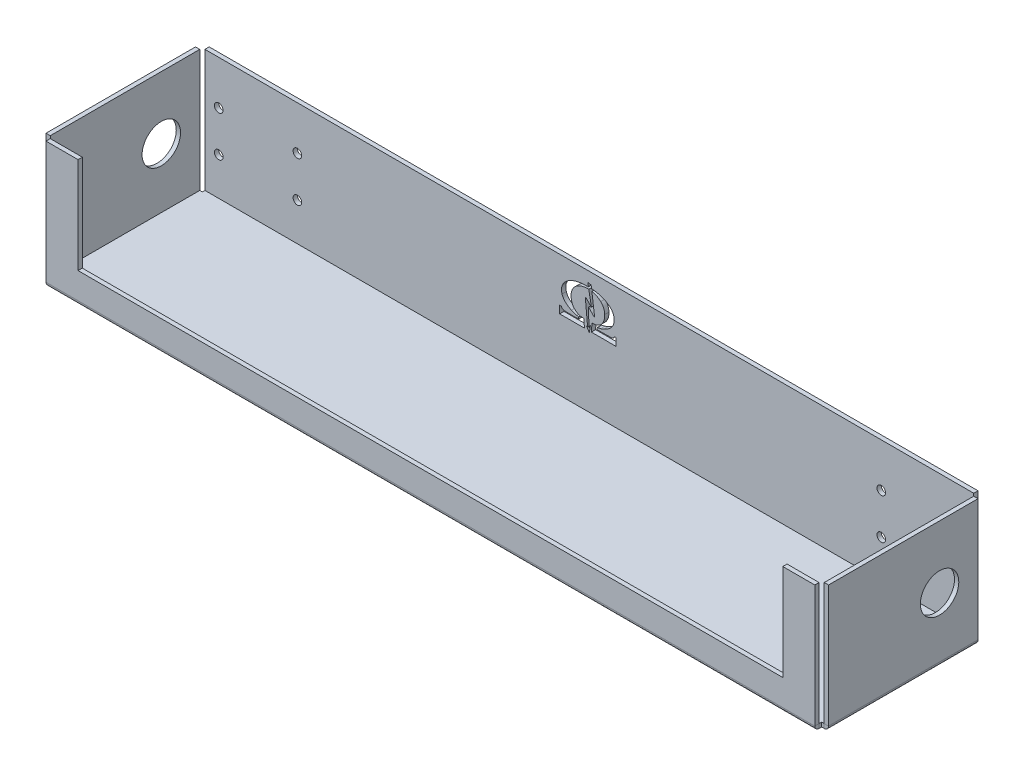
from build123d import *

# Parameters (mm, degrees)
FLANGE_BASE1_DEPTH                             = 2
DOBRA_START                                    = -48.25
DOBRA_ESBO_ADA1_OUTLINE_W                      = 2
DOBRA_ESBO_ADA1_OUTLINE_H                      = 57.214601837
DOBRA_ESBO_ADA1_DEPTH                          = 70
DOBRA_START_2                                  = -180
DOBRA_ESBO_ADA1_2_OUTLINE_W                    = 57.214601837
DOBRA_ESBO_ADA1_2_OUTLINE_H                    = 2
DOBRA_ESBO_ADA1_2_DEPTH                        = 360
DOBRA_START_3                                  = -108.25
DOBRA_ESBO_ADA1_3_OUTLINE_W                    = 360
DOBRA_ESBO_ADA1_3_OUTLINE_H                    = 2
DOBRA_ESBO_ADA1_3_DEPTH                        = 56.785398163
DOBRA_START_4                                  = 24.964601837
DOBRA_ESBO_ADA1_4_OUTLINE_W                    = 360
DOBRA_ESBO_ADA1_4_OUTLINE_H                    = 2
DOBRA_ESBO_ADA1_4_DEPTH                        = 56.785398163
DOBRA_ESBO_ADA1_5_DEPTH                        = 70
DOBRA_ESBO_ADA1_6_DEPTH                        = 360
DOBRA_START_5                                  = -240
DOBRA_ESBO_ADA1_7_OUTLINE_W                    = 2
DOBRA_ESBO_ADA1_7_OUTLINE_H                    = 70
DOBRA_ESBO_ADA1_7_DEPTH                        = 56.785398163
DOBRA_START_6                                  = 183.214601837
DOBRA_ESBO_ADA1_8_OUTLINE_W                    = 2
DOBRA_ESBO_ADA1_8_OUTLINE_H                    = 70
DOBRA_ESBO_ADA1_8_DEPTH                        = 56.785398163
FURO1_START                                    = -183.214601837
FURO1_OUTLINE_R                                = 9
FURO1_DEPTH                                    = 366.429203674
CORTE_EXTRUS_O1_REACH                          = 208.597
ESBO_O9_W                                      = 330
ESBO_O9_H                                      = 45
BROCA_DE_ROSQUEAR_DE_CANO_PARA_TARRAXA_D_D     = 4.04
BROCA_DE_ROSQUEAR_DE_CANO_PARA_TARRAXA_D_DEPTH = 10
BROCA_DE_ROSQUEAR_DE_CANO_PARA_TARRAXA_D_TIP   = 1.21373845
CORTE_EXTRUS_O13_DEPTH                         = 10
CORTE_EXTRUS_O17_DEPTH                         = 10
CORTE_EXTRUS_O19_REACH                         = 208.597


# Read off the part's stored shape, not the designer's step: Dobra esboçada1, Furo1
# Sheet-metal steps are written as plain solids
with BuildPart() as part:
    # Esboço1 → Flange-base1 (new body)
    with BuildSketch(Plane(origin=(0, 0, 0), x_dir=(1, 0, 0), z_dir=(0, 1, 0))):
        Polygon((180, 108.25), (180, 48.25), (240, 48.25), (240, -21.75), (180, -21.75), (180, -81.75), (-180, -81.75), (-180, -21.75), (-240, -21.75), (-240, 48.25), (-180, 48.25), (-180, 108.25), align=None)
    extrude(amount=-FLANGE_BASE1_DEPTH)

    # Dobra esboçada1 outline → Dobra esboçada1 (add)
    with BuildSketch(Plane.XY.offset(DOBRA_START)):
        with Locations((182.214601837, 28.607300919)):
            Rectangle(DOBRA_ESBO_ADA1_OUTLINE_W, DOBRA_ESBO_ADA1_OUTLINE_H)
        with Locations((-182.214601837, 28.607300919)):
            Rectangle(DOBRA_ESBO_ADA1_OUTLINE_W, DOBRA_ESBO_ADA1_OUTLINE_H)
    extrude(amount=DOBRA_ESBO_ADA1_DEPTH)

    # Dobra esbo_ada1 2 outline → Dobra esbo_ada1 2 (add)
    with BuildSketch(Plane.YZ.offset(DOBRA_START_2)):
        with Locations((28.607300919, -50.464601837)):
            Rectangle(DOBRA_ESBO_ADA1_2_OUTLINE_W, DOBRA_ESBO_ADA1_2_OUTLINE_H)
        with Locations((28.607300919, 23.964601837)):
            Rectangle(DOBRA_ESBO_ADA1_2_OUTLINE_W, DOBRA_ESBO_ADA1_2_OUTLINE_H)
    extrude(amount=DOBRA_ESBO_ADA1_2_DEPTH)

    # Dobra esbo_ada1 3 outline → Dobra esbo_ada1 3 (cut)
    with BuildSketch(Plane.XY.offset(DOBRA_START_3)):
        with Locations((0, -1)):
            Rectangle(DOBRA_ESBO_ADA1_3_OUTLINE_W, DOBRA_ESBO_ADA1_3_OUTLINE_H)
    extrude(amount=DOBRA_ESBO_ADA1_3_DEPTH, mode=Mode.SUBTRACT)

    # Dobra esbo_ada1 4 outline → Dobra esbo_ada1 4 (cut)
    with BuildSketch(Plane.XY.offset(DOBRA_START_4)):
        with Locations((0, -1)):
            Rectangle(DOBRA_ESBO_ADA1_4_OUTLINE_W, DOBRA_ESBO_ADA1_4_OUTLINE_H)
    extrude(amount=DOBRA_ESBO_ADA1_4_DEPTH, mode=Mode.SUBTRACT)

    # Dobra esbo_ada1 5 outline → Dobra esbo_ada1 5 (cut)
    with BuildSketch(Plane.XY.offset(DOBRA_START)):
        with BuildLine():
            Line((240, 0), (183.214601837, 0))
            ThreePointArc((183.214601837, 0), (182.628815399, -1.414213562), (181.214601837, -2))
            Line((181.214601837, -2), (240, -2))
            Line((240, -2), (240, 0))
        make_face()
        with BuildLine():
            Line((-240, -2), (-181.214601837, -2))
            ThreePointArc((-181.214601837, -2), (-182.628815399, -1.414213562), (-183.214601837, 0))
            Line((-183.214601837, 0), (-240, 0))
            Line((-240, 0), (-240, -2))
        make_face()
    extrude(amount=DOBRA_ESBO_ADA1_5_DEPTH, mode=Mode.SUBTRACT)

    # Dobra esbo_ada1 6 outline → Dobra esbo_ada1 6 (cut)
    with BuildSketch(Plane.YZ.offset(DOBRA_START_2)):
        with BuildLine():
            Line((0, -108.25), (0, -51.464601837))
            ThreePointArc((0, -51.464601837), (-1.414213562, -50.878815399), (-2, -49.464601837))
            Line((-2, -49.464601837), (-2, -108.25))
            Line((-2, -108.25), (0, -108.25))
        make_face()
        with BuildLine():
            Line((-2, 81.75), (-2, 22.964601837))
            ThreePointArc((-2, 22.964601837), (-1.414213562, 24.378815399), (0, 24.964601837))
            Line((0, 24.964601837), (0, 81.75))
            Line((0, 81.75), (-2, 81.75))
        make_face()
    extrude(amount=DOBRA_ESBO_ADA1_6_DEPTH, mode=Mode.SUBTRACT)

    # Dobra esbo_ada1 7 outline → Dobra esbo_ada1 7 (cut)
    with BuildSketch(Plane.YZ.offset(DOBRA_START_5)):
        with Locations((-1, -13.25)):
            Rectangle(DOBRA_ESBO_ADA1_7_OUTLINE_W, DOBRA_ESBO_ADA1_7_OUTLINE_H)
    extrude(amount=DOBRA_ESBO_ADA1_7_DEPTH, mode=Mode.SUBTRACT)

    # Dobra esbo_ada1 8 outline → Dobra esbo_ada1 8 (cut)
    with BuildSketch(Plane.YZ.offset(DOBRA_START_6)):
        with Locations((-1, -13.25)):
            Rectangle(DOBRA_ESBO_ADA1_8_OUTLINE_W, DOBRA_ESBO_ADA1_8_OUTLINE_H)
    extrude(amount=DOBRA_ESBO_ADA1_8_DEPTH, mode=Mode.SUBTRACT)

    # Furo1 outline → Furo1 (cut)
    with BuildSketch(Plane.YZ.offset(FURO1_START)):
        with Locations((28, -30.25)):
            Circle(FURO1_OUTLINE_R)
    extrude(amount=FURO1_DEPTH, mode=Mode.SUBTRACT)

    # Esboço9 → Corte-extrusão1 (cut, up to next)
    with BuildSketch(Plane.XY.offset(24.964601837), mode=Mode.PRIVATE) as corte_extrus_o1_sk1:
        with Locations((0, 34.714601837)):
            Rectangle(ESBO_O9_W, ESBO_O9_H)
    corte_extrus_o1_tool1 = extrude(corte_extrus_o1_sk1.sketch, amount=-CORTE_EXTRUS_O1_REACH, mode=Mode.PRIVATE) & part.part
    add(corte_extrus_o1_tool1.solids().sort_by_distance((0, 34.714602, 24.964602))[0], mode=Mode.SUBTRACT)

    # Broca de rosquear de cano para tarraxa de 1/81
    with Locations(Plane(origin=(0, 0, -51.464601837), x_dir=(-1, 0, 0), z_dir=(0, 0, -1))):
        with Locations((-173.534601837, 36.714601837), (-136.704601837, 36.714601837), (-136.704601837, 17.714601837), (-173.534601837, 17.714601837), (136.704601837, 36.714601837), (136.704601837, 17.714601837), (173.534601837, 17.714601837), (173.534601837, 36.714601837)):
            Hole(BROCA_DE_ROSQUEAR_DE_CANO_PARA_TARRAXA_D_D / 2, depth=BROCA_DE_ROSQUEAR_DE_CANO_PARA_TARRAXA_D_DEPTH)
            with Locations((0, 0, -(BROCA_DE_ROSQUEAR_DE_CANO_PARA_TARRAXA_D_DEPTH + BROCA_DE_ROSQUEAR_DE_CANO_PARA_TARRAXA_D_TIP / 2))):  # 118° drill point
                Cone(0, BROCA_DE_ROSQUEAR_DE_CANO_PARA_TARRAXA_D_D / 2, BROCA_DE_ROSQUEAR_DE_CANO_PARA_TARRAXA_D_TIP, mode=Mode.SUBTRACT)

    # Esboço18 → Corte-extrusão13 (cut)
    with BuildSketch(Plane(origin=(0, 0, -51.464601837), x_dir=(-1, 0, 0), z_dir=(0, 0, -1))):
        with BuildLine():
            add(Edge.make_bspline(
                [(-7.181231252, 43.249745192), (-7.146688462, 45.281829003), (-6.349114649, 46.622466356), (-5.339149821, 47.603329367)],
                knots=[0.358208955, 0.358208955, 0.358208955, 0.358208955, 0.373134328, 0.373134328, 0.373134328, 0.373134328], degree=3))
            add(Edge.make_bspline(
                [(-5.339149821, 47.603329367), (-4.413923306, 48.501884896), (-2.877422317, 49.421216078), (-1.215926637, 49.667899984)],
                knots=[0.373134328, 0.373134328, 0.373134328, 0.373134328, 0.388059701, 0.388059701, 0.388059701, 0.388059701], degree=3))
            Line((-1.215926637, 49.667899984), (-1.088773731, 50.680011668))
            Line((-1.088773731, 50.680011668), (-2.949858808, 50.45671599))
            add(Edge.make_bspline(
                [(-2.949858808, 50.45671599), (-4.353084378, 50.303596358), (-6.472882566, 49.616523122), (-7.63104857, 48.969433649)],
                knots=[0.089552239, 0.089552239, 0.089552239, 0.089552239, 0.104477612, 0.104477612, 0.104477612, 0.104477612], degree=3))
            add(Edge.make_bspline(
                [(-7.63104857, 48.969433649), (-9.363151938, 48.001678951), (-10.94740626, 46.794339735), (-11.495751746, 44.591688832)],
                knots=[0.104477612, 0.104477612, 0.104477612, 0.104477612, 0.119402985, 0.119402985, 0.119402985, 0.119402985], degree=3))
            add(Edge.make_bspline(
                [(-11.495751746, 44.591688832), (-12.156108558, 41.93910702), (-10.736014839, 39.783028112), (-9.407633873, 38.717347275)],
                knots=[0.119402985, 0.119402985, 0.119402985, 0.119402985, 0.134328358, 0.134328358, 0.134328358, 0.134328358], degree=3))
            add(Edge.make_bspline(
                [(-9.407633873, 38.717347275), (-8.632687234, 38.095645218), (-7.880924362, 37.614499714), (-6.831998084, 37.168226411)],
                knots=[0.134328358, 0.134328358, 0.134328358, 0.134328358, 0.149253731, 0.149253731, 0.149253731, 0.149253731], degree=3))
            add(Edge.make_bspline(
                [(-6.831998084, 37.168226411), (-6.325067597, 36.952552638), (-5.870808901, 36.766298734), (-5.309196077, 36.610430218)],
                knots=[0.149253731, 0.149253731, 0.149253731, 0.149253731, 0.164179104, 0.164179104, 0.164179104, 0.164179104], degree=3))
            Line((-5.309196077, 36.610430218), (-4.037587509, 36.319775533))
            add(Edge.make_bspline(
                [(-4.037587509, 36.319775533), (-3.980292596, 36.311006367), (-3.907060973, 36.300885478), (-3.830876005, 36.287436394)],
                knots=[0.179104478, 0.179104478, 0.179104478, 0.179104478, 0.194029851, 0.194029851, 0.194029851, 0.194029851], degree=3))
            Line((-3.830876005, 36.287436394), (-3.625993304, 36.21736258))
            Line((-3.625993304, 36.21736258), (-3.613055376, 35.343444772))
            add(Edge.make_bspline(
                [(-3.613055376, 35.343444772), (-4.750025443, 35.338719419), (-9.564865472, 35.241906464), (-10.491409634, 35.501301118)],
                knots=[0.223880597, 0.223880597, 0.223880597, 0.223880597, 0.23880597, 0.23880597, 0.23880597, 0.23880597], degree=3))
            add(Edge.make_bspline(
                [(-10.491409634, 35.501301118), (-10.933332431, 35.625023598), (-11.362919328, 35.770350941), (-11.596699385, 36.169984094)],
                knots=[0.23880597, 0.23880597, 0.23880597, 0.23880597, 0.253731343, 0.253731343, 0.253731343, 0.253731343], degree=3))
            add(Edge.make_bspline(
                [(-11.596699385, 36.169984094), (-11.665410116, 36.287436394), (-11.707302193, 36.438897609), (-11.782146797, 36.534029428)],
                knots=[0.253731343, 0.253731343, 0.253731343, 0.253731343, 0.268656716, 0.268656716, 0.268656716, 0.268656716], degree=3))
            Line((-11.782146797, 36.534029428), (-12.51529223, 36.531950727))
            Line((-12.51529223, 36.531950727), (-12.508022456, 32.980722514))
            add(Edge.make_bspline(
                [(-12.508022456, 32.980722514), (-12.325358004, 33.045332638), (-1.971699244, 33.033348869), (-0.9179681, 33.008642993)],
                knots=[0.298507463, 0.298507463, 0.298507463, 0.298507463, 0.313432836, 0.313432836, 0.313432836, 0.313432836], degree=3))
            add(Edge.make_bspline(
                [(-0.9179681, 33.008642993), (-0.884186365, 33.460027856), (-1.298279555, 36.522511379), (-1.216608178, 36.820220018)],
                knots=[0.313432836, 0.313432836, 0.313432836, 0.313432836, 0.328358209, 0.328358209, 0.328358209, 0.328358209], degree=3))
            add(Edge.make_bspline(
                [(-1.216608178, 36.820220018), (-2.342843968, 36.890452858), (-2.938045423, 36.901561983), (-3.846324276, 37.296935503)],
                knots=[0.328358209, 0.328358209, 0.328358209, 0.328358209, 0.343283582, 0.343283582, 0.343283582, 0.343283582], degree=3))
            add(Edge.make_bspline(
                [(-3.846324276, 37.296935503), (-6.131294021, 38.29156565), (-7.227803247, 40.510369084), (-7.181231252, 43.249745192)],
                knots=[0.343283582, 0.343283582, 0.343283582, 0.343283582, 0.358208955, 0.358208955, 0.358208955, 0.358208955], degree=3))
        make_face()
        with BuildLine():
            add(Edge.make_bspline(
                [(12.633494226, 45.334205459), (11.811191819, 47.297885233), (10.044727406, 48.579932744), (7.998456175, 49.456133715)],
                knots=[0.955223881, 0.955223881, 0.955223881, 0.955223881, 0.970149254, 0.970149254, 0.970149254, 0.970149254], degree=3))
            add(Edge.make_bspline(
                [(7.998456175, 49.456133715), (5.822896541, 50.387687206), (3.226235201, 50.727219768), (0.465526847, 50.721642488)],
                knots=[0.970149254, 0.970149254, 0.970149254, 0.970149254, 1, 1, 1, 1], degree=3))
            Line((0.465526847, 50.721642488), (0.280340692, 49.793792038))
            Line((0.280340692, 49.793792038), (1.138412662, 49.826460589))
            add(Edge.make_bspline(
                [(1.138412662, 49.826460589), (1.368603267, 49.808570127), (1.676114743, 49.788805427), (1.905612447, 49.76110077)],
                knots=[0.71641791, 0.71641791, 0.71641791, 0.71641791, 0.731343284, 0.731343284, 0.731343284, 0.731343284], degree=3))
            add(Edge.make_bspline(
                [(1.905612447, 49.76110077), (6.298158071, 49.230963799), (9.355018877, 46.111242158), (8.371100289, 41.277591587)],
                knots=[0.731343284, 0.731343284, 0.731343284, 0.731343284, 0.746268657, 0.746268657, 0.746268657, 0.746268657], degree=3))
            add(Edge.make_bspline(
                [(8.371100289, 41.277591587), (8.018345824, 39.544624933), (6.958492166, 38.172886575), (5.427318559, 37.392533042)],
                knots=[0.746268657, 0.746268657, 0.746268657, 0.746268657, 0.76119403, 0.76119403, 0.76119403, 0.76119403], degree=3))
            add(Edge.make_bspline(
                [(5.427318559, 37.392533042), (4.163559076, 36.748453709), (3.172847792, 36.927165221), (2.615312857, 36.811200953)],
                knots=[0.76119403, 0.76119403, 0.76119403, 0.76119403, 0.776119403, 0.776119403, 0.776119403, 0.776119403], degree=3))
            Line((2.615312857, 36.811200953), (2.278688205, 33.010880721))
            Line((2.278688205, 33.010880721), (13.87886345, 33.008631634))
            Line((13.87886345, 33.008631634), (13.891233427, 36.534324763))
            Line((13.891233427, 36.534324763), (13.14208313, 36.531644034))
            add(Edge.make_bspline(
                [(13.14208313, 36.531644034), (13.063876255, 36.413862322), (13.033888434, 36.27260151), (12.944833692, 36.134861995)],
                knots=[0.835820896, 0.835820896, 0.835820896, 0.835820896, 0.850746269, 0.850746269, 0.850746269, 0.850746269], degree=3))
            add(Edge.make_bspline(
                [(12.944833692, 36.134861995), (12.70601023, 35.765466561), (12.260657008, 35.594195209), (11.816405611, 35.490362378)],
                knots=[0.850746269, 0.850746269, 0.850746269, 0.850746269, 0.865671642, 0.865671642, 0.865671642, 0.865671642], degree=3))
            add(Edge.make_bspline(
                [(11.816405611, 35.490362378), (10.801545044, 35.253163256), (6.075316755, 35.310287784), (4.964040798, 35.34743179)],
                knots=[0.865671642, 0.865671642, 0.865671642, 0.865671642, 0.880597015, 0.880597015, 0.880597015, 0.880597015], degree=3))
            Line((4.964040798, 35.34743179), (5.008693119, 36.202834389))
            add(Edge.make_bspline(
                [(5.008693119, 36.202834389), (5.135993691, 36.314822999), (5.617468607, 36.34842299), (5.933465273, 36.419462321)],
                knots=[0.895522388, 0.895522388, 0.895522388, 0.895522388, 0.910447761, 0.910447761, 0.910447761, 0.910447761], degree=3))
            add(Edge.make_bspline(
                [(5.933465273, 36.419462321), (6.903571289, 36.637544207), (7.484471735, 36.85007153), (8.384469859, 37.251169998)],
                knots=[0.910447761, 0.910447761, 0.910447761, 0.910447761, 0.925373134, 0.925373134, 0.925373134, 0.925373134], degree=3))
            add(Edge.make_bspline(
                [(8.384469859, 37.251169998), (10.308574797, 38.108651299), (12.130107754, 39.497314601), (12.778901081, 41.620043418)],
                knots=[0.925373134, 0.925373134, 0.925373134, 0.925373134, 0.940298507, 0.940298507, 0.940298507, 0.940298507], degree=3))
            add(Edge.make_bspline(
                [(12.778901081, 41.620043418), (13.13184865, 42.774824433), (13.083027568, 44.260686896), (12.633494226, 45.334205459)],
                knots=[0.940298507, 0.940298507, 0.940298507, 0.940298507, 0.955223881, 0.955223881, 0.955223881, 0.955223881], degree=3))
        make_face()
    extrude(amount=-CORTE_EXTRUS_O13_DEPTH, mode=Mode.SUBTRACT)

    # Esboço27 → Corte-extrusão17 (cut)
    with BuildSketch(Plane(origin=(0, 0, -51.464601837), x_dir=(-1, 0, 0), z_dir=(0, 0, -1))):
        Polygon((0, 32.214601837), (1.060853252, 33.986927506), (1.416686012, 34.588853503), (1.201671906, 34.467048323), (0.95099322, 34.339356712), (0.814737297, 34.29910754), (1.919016095, 46.068850284), (-0.184958974, 43.891870773), (-0.967368491, 43.189951294), (0.246766687, 49.770115763), (0.479207176, 50.934727733), (0.732759227, 52.38125257), (-0.852097124, 52.065608034), (-1.077805381, 50.656043764), (-1.201947167, 49.667899984), (-1.360072641, 48.370415561), (-1.851702523, 44.609681525), (-2.502767655, 39.610109702), (0.015857196, 42.128166602), (0.196102176, 42.308116247), (0.4444445, 42.47320829), (0.365874137, 40.437307847), (0.298901336, 38.400203347), (0.218752068, 36.396585248), (0.149325719, 34.914823392), (0.134800259, 34.551707489), (0.096392671, 34.455157801), (0.043680289, 34.477830199), (0.014778089, 34.5140089), (-0.527172266, 35.610427253), align=None)
    extrude(amount=-CORTE_EXTRUS_O17_DEPTH, mode=Mode.SUBTRACT)

    # Esboço29 → Corte-extrusão19 (cut, up to next)
    with BuildSketch(Plane(origin=(0, 0, -51.464601837), x_dir=(-1, 0, 0), z_dir=(0, 0, -1)), mode=Mode.PRIVATE) as corte_extrus_o19_sk1:
        Polygon((0.465526847, 50.721642488), (0.437783448, 50.727179688), (0.25098976, 49.791274908), (0.280340692, 49.793792038), align=None)
    corte_extrus_o19_tool1 = extrude(corte_extrus_o19_sk1.sketch, amount=-CORTE_EXTRUS_O19_REACH, mode=Mode.PRIVATE) & part.part
    # Esboço29 → Corte-extrusão19 (cut, up to next)
    with BuildSketch(Plane(origin=(0, 0, -51.464601837), x_dir=(-1, 0, 0), z_dir=(0, 0, -1)), mode=Mode.PRIVATE) as corte_extrus_o19_sk2:
        Polygon((-1.215926637, 49.667899984), (-1.201947167, 49.667899984), (-1.07360936, 50.682248212), (-1.088773731, 50.680011668), align=None)
    corte_extrus_o19_tool2 = extrude(corte_extrus_o19_sk2.sketch, amount=-CORTE_EXTRUS_O19_REACH, mode=Mode.PRIVATE) & part.part
    add(corte_extrus_o19_tool1.solids().sort_by_distance((-0.35864, 50.258473, -51.464602))[0], mode=Mode.SUBTRACT)
    add(corte_extrus_o19_tool2.solids().sort_by_distance((1.144396, 50.179798, -51.464602))[0], mode=Mode.SUBTRACT)


solid = part.part
